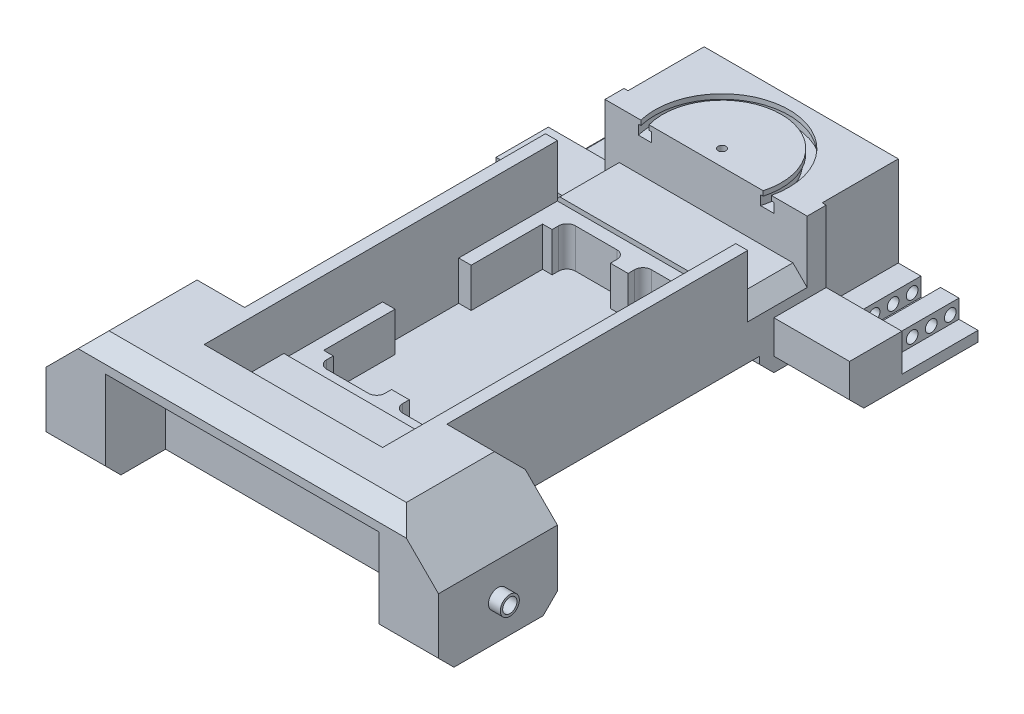
from build123d import *

# Parameters (mm, degrees)
SKETCH1_W           = 40
SKETCH1_H           = 60
SKETCH1_W_2         = 85
SKETCH1_H_2         = 125
SKETCH1_W_3         = 75
SKETCH1_H_3         = 115
SKETCH1_H_4         = 25
BOSS_EXTRUDE1_DEPTH = 22
SKETCH2_W           = 85
SKETCH2_H           = 125
BOSS_EXTRUDE2_DEPTH = 16.5
SKETCH4_W           = 85
SKETCH4_H           = 125
BOSS_EXTRUDE3_DEPTH = 2.5
BOSS_EXTRUDE4_DEPTH = 50
SKETCH9_W           = 40
SKETCH9_H           = 6
CUT_EXTRUDE2_DEPTH  = 50
SKETCH8_W           = 8.185
SKETCH8_H           = 4.325
SKETCH8_W_2         = 9.5
SKETCH8_H_2         = 37.925
CUT_EXTRUDE1_DEPTH  = 32
SKETCH10_W          = 40
SKETCH10_H          = 22
CUT_EXTRUDE3_DEPTH  = 30
SKETCH11_W          = 22
SKETCH11_H          = 20
CUT_EXTRUDE4_DEPTH  = 8.185
SKETCH12_W          = 75
SKETCH12_H          = 25
SKETCH12_W_2        = 5
CUT_EXTRUDE5_DEPTH  = 20
CHAMFER1_SIZE       = 6
CHAMFER2_SIZE       = 6
SKETCH14_W          = 75
SKETCH14_H          = 17.5
CUT_EXTRUDE6_DEPTH  = 20
SKETCH18_W          = 25
SKETCH18_H          = 50
BOSS_EXTRUDE5_DEPTH = 165
CHAMFER3_SIZE       = 16
SKETCH19_R          = 3
CUT_EXTRUDE7_DEPTH  = 20
CHAMFER4_SIZE       = 6.5
CHAMFER5_SIZE       = 6.5
SKETCH20_W          = 115
SKETCH20_H          = 18.75
SKETCH20_H_2        = 6.5
CUT_EXTRUDE8_DEPTH  = 20
CHAMFER6_SIZE       = 6.5
CHAMFER8_SIZE       = 20
CHAMFER9_SIZE       = 20
SKETCH21_R          = 2.45
CUT_EXTRUDE9_DEPTH  = 30
SKETCH22_R          = 4
SKETCH22_R_2        = 3
BOSS_EXTRUDE6_DEPTH = 5
SKETCH23_R          = 2.7
SKETCH23_R_2        = 1.65
CUT_EXTRUDE10_DEPTH = 6
BOSS_EXTRUDE7_START = -2
BOSS_EXTRUDE7_DEPTH = 2


# Read off the part's stored shape, not the designer's step: Boss-Extrude7
# Some blends are built 0.0001 mm under size
with BuildPart() as part:
    # Sketch1 → Boss-Extrude1 (new body)
    # profile 1 of 7: a face of its own
    with BuildSketch(Plane(origin=(0, 0, 0), x_dir=(1, 0, 0), z_dir=(0, 1, 0))):
        with Locations((-25, 150)):
            Rectangle(SKETCH1_W, SKETCH1_H)
    # profile 2 of 7: a face of its own
    with BuildSketch(Plane(origin=(0, 0, 0), x_dir=(1, 0, 0), z_dir=(0, 1, 0))):
        with Locations((37.5, 150)):
            Rectangle(SKETCH1_W_2, SKETCH1_H)
    # profile 3 of 7: a face of its own
    with BuildSketch(Plane(origin=(0, 0, 0), x_dir=(1, 0, 0), z_dir=(0, 1, 0))):
        with Locations((100, 150)):
            Rectangle(SKETCH1_W, SKETCH1_H)
    # profile 4 of 7: a face of its own
    with BuildSketch(Plane(origin=(0, 0, 0), x_dir=(1, 0, 0), z_dir=(0, 1, 0))):
        with Locations((37.5, 57.5)):
            Rectangle(SKETCH1_W_2, SKETCH1_H_2)
        with Locations((37.5, 57.5)):
            Rectangle(SKETCH1_W_3, SKETCH1_H_3, mode=Mode.SUBTRACT)
    # profile 5 of 7: a face of its own
    with BuildSketch(Plane(origin=(0, 0, 0), x_dir=(1, 0, 0), z_dir=(0, 1, 0))):
        with Locations((-25, -17.5)):
            Rectangle(SKETCH1_W, SKETCH1_H_4)
    # profile 6 of 7: a face of its own
    with BuildSketch(Plane(origin=(0, 0, 0), x_dir=(1, 0, 0), z_dir=(0, 1, 0))):
        with Locations((37.5, -17.5)):
            Rectangle(SKETCH1_W_2, SKETCH1_H_4)
    # profile 7 of 7: a face of its own
    with BuildSketch(Plane(origin=(0, 0, 0), x_dir=(1, 0, 0), z_dir=(0, 1, 0))):
        with Locations((100, -17.5)):
            Rectangle(SKETCH1_W, SKETCH1_H_4)
    extrude(amount=-BOSS_EXTRUDE1_DEPTH)

    # Sketch2 → Boss-Extrude2 (add)
    with BuildSketch(Plane.XZ.offset(22)):
        with Locations((37.5, -57.5)):
            Rectangle(SKETCH2_W, SKETCH2_H)
        with BuildLine():
            Line((5.25, -11.5), (9.275, -11.5))
            Line((9.275, -11.5), (9.275, -8.75))
            ThreePointArc((9.275, -8.75), (10.300126266, -6.275126266), (12.775, -5.25))
            Line((12.775, -5.25), (30.275, -5.25))
            ThreePointArc((30.275, -5.25), (32.749873734, -6.275126266), (33.775, -8.75))
            Line((33.775, -8.75), (33.775, -11.5))
            Line((33.775, -11.5), (41.223, -11.5))
            Line((41.223, -11.5), (41.223, -8.75))
            ThreePointArc((41.223, -8.75), (42.248126266, -6.275126266), (44.723, -5.25))
            Line((44.723, -5.25), (62.223, -5.25))
            ThreePointArc((62.223, -5.25), (64.697873734, -6.275126266), (65.723, -8.75))
            Line((65.723, -8.75), (65.723, -11.5))
            Line((65.723, -11.5), (69.75, -11.5))
            Line((69.75, -11.5), (69.75, -41.5))
            Line((69.75, -41.5), (75, -41.5))
            Line((75, -41.5), (75, -73.5))
            Line((75, -73.5), (69.75, -73.5))
            Line((69.75, -73.5), (69.75, -103.5))
            Line((69.75, -103.5), (65.723, -103.5))
            Line((65.723, -103.5), (65.723, -106.25))
            ThreePointArc((65.723, -106.25), (64.697873734, -108.724873734), (62.223, -109.75))
            Line((62.223, -109.75), (44.723, -109.75))
            ThreePointArc((44.723, -109.75), (42.248126266, -108.724873734), (41.223, -106.25))
            Line((41.223, -106.25), (41.223, -103.5))
            Line((41.223, -103.5), (33.775, -103.5))
            Line((33.775, -103.5), (33.775, -106.25))
            ThreePointArc((33.775, -106.25), (32.749873734, -108.724873734), (30.275, -109.75))
            Line((30.275, -109.75), (12.775, -109.75))
            ThreePointArc((12.775, -109.75), (10.300126266, -108.724873734), (9.275, -106.25))
            Line((9.275, -106.25), (9.275, -103.5))
            Line((9.275, -103.5), (5.25, -103.5))
            Line((5.25, -103.5), (5.25, -73.5))
            Line((5.25, -73.5), (0, -73.5))
            Line((0, -73.5), (0, -41.5))
            Line((0, -41.5), (5.25, -41.5))
            Line((5.25, -41.5), (5.25, -11.5))
        make_face(mode=Mode.SUBTRACT)
    extrude(amount=BOSS_EXTRUDE2_DEPTH)

    # Sketch4 → Boss-Extrude3 (add)
    with BuildSketch(Plane.XZ.offset(38.5)):
        with Locations((37.5, -57.5)):
            Rectangle(SKETCH4_W, SKETCH4_H)
    extrude(amount=BOSS_EXTRUDE3_DEPTH)

    # Sketch5 → Boss-Extrude4 (add)
    with BuildSketch(Plane(origin=(0, 0, 0), x_dir=(1, 0, 0), z_dir=(0, 1, 0))):
        Polygon((120, 180), (-45, 180), (-45, 120), (-5, 120), (80, 120), (120, 120), align=None)
        Polygon((-5, -5), (-45, -5), (-45, -30), (120, -30), (120, -5), (80, -5), align=None)
    extrude(amount=-BOSS_EXTRUDE4_DEPTH)

    # Sketch9 → Cut-Extrude2 (cut)
    with BuildSketch(Plane(origin=(0, 0, 0), x_dir=(1, 0, 0), z_dir=(0, 1, 0))):
        with Locations((-25, 123)):
            Rectangle(SKETCH9_W, SKETCH9_H)
        with Locations((100, 123)):
            Rectangle(SKETCH9_W, SKETCH9_H)
    extrude(amount=-CUT_EXTRUDE2_DEPTH, mode=Mode.SUBTRACT)

    # Sketch8 → Cut-Extrude1 (cut)
    with BuildSketch(Plane(origin=(0, 0, -180), x_dir=(-1, 0, 0), z_dir=(0, 0, -1))):
        Polygon((-87.815, 0), (-120, 0), (-120, -45.675), (-111.815, -45.675), (-103.815, -45.675), (-103.815, -37.925), (-96.065, -37.925), (-96.065, -45.675), (-87.815, -45.675), (-87.815, -37.925), align=None)
        with Locations((-115.9075, -47.8375)):
            Rectangle(SKETCH8_W, SKETCH8_H)
        with Locations((-83.065, -18.9625)):
            Rectangle(SKETCH8_W_2, SKETCH8_H_2)
    cut_extrude1 = extrude(amount=-CUT_EXTRUDE1_DEPTH, mode=Mode.SUBTRACT)

    # Sketch10 → Cut-Extrude3 (cut)
    with BuildSketch(Plane(origin=(0, 0, 0), x_dir=(1, 0, 0), z_dir=(0, 1, 0))):
        with Locations((100, 137)):
            Rectangle(SKETCH10_W, SKETCH10_H)
    cut_extrude3 = extrude(amount=-CUT_EXTRUDE3_DEPTH, mode=Mode.SUBTRACT)

    # Sketch11 → Cut-Extrude4 (cut)
    with BuildSketch(Plane(origin=(120, 0, 0), x_dir=(0, 0, -1), z_dir=(1, 0, 0))):
        with Locations((137, -40)):
            Rectangle(SKETCH11_W, SKETCH11_H)
    cut_extrude4 = extrude(amount=-CUT_EXTRUDE4_DEPTH, mode=Mode.SUBTRACT)

    # Sketch12 → Cut-Extrude5 (cut)
    with BuildSketch(Plane(origin=(0, 0, 0), x_dir=(1, 0, 0), z_dir=(0, 1, 0))):
        with Locations((37.5, 127.5)):
            Rectangle(SKETCH12_W, SKETCH12_H)
        with Locations((77.5, 127.5)):
            Rectangle(SKETCH12_W_2, SKETCH12_H)
    cut_extrude5 = extrude(amount=-CUT_EXTRUDE5_DEPTH, mode=Mode.SUBTRACT)

    # Mirror4: Cut-Extrude1, Cut-Extrude3, Cut-Extrude4, Cut-Extrude5 across plane
    add(cut_extrude1.mirror(Plane.ZY.offset(-37.5)), mode=Mode.SUBTRACT)
    add(cut_extrude3.mirror(Plane.ZY.offset(-37.5)), mode=Mode.SUBTRACT)
    add(cut_extrude4.mirror(Plane.ZY.offset(-37.5)), mode=Mode.SUBTRACT)
    add(cut_extrude5.mirror(Plane.ZY.offset(-37.5)), mode=Mode.SUBTRACT)

    # Chamfer1
    # the kernel refuses this chamfer: 6 mm, written as the material it takes off along each edge
    with BuildSketch(Plane(origin=(80, -20, -115), x_dir=(0.02749587661058678, -0.9996219169112968, 0), z_dir=(0, 0, -1))) as chamfer1_piece_1:
        Polygon((CHAMFER1_SIZE * 0.999621916911, CHAMFER1_SIZE * 0.0274958766106), (-CHAMFER1_SIZE * 0.0274958766106, CHAMFER1_SIZE * 0.999621916911), (0, 0), align=None)
    extrude(amount=25, mode=Mode.SUBTRACT)
    with BuildSketch(Plane(origin=(-5, -20, -115), x_dir=(-0.027495876610588648, -0.9996219169112965, 0), z_dir=(0, 0, -1))) as chamfer1_piece_2:
        Polygon((CHAMFER1_SIZE * 0.999621916911, -CHAMFER1_SIZE * 0.0274958766106), (-CHAMFER1_SIZE * 0.0274958766106, -CHAMFER1_SIZE * 0.999621916911), (0, 0), align=None)
    extrude(amount=25, mode=Mode.SUBTRACT)

    # Chamfer2
    chamfer2_edges = [part.edges().sort_by_distance(p)[0] for p in [
        (95.9075, -50, -126),
        (-20.9075, -50, -126),
        (37.5, -50, 5),
        (37.5, -50, -120),
    ]]
    chamfer(chamfer2_edges, length=CHAMFER2_SIZE - 0.0001)  # a hair under: the kernel refuses the full size

    # Sketch14 → Cut-Extrude6 (cut)
    with BuildSketch(Plane(origin=(0, 0, 0), x_dir=(1, 0, 0), z_dir=(0, 1, 0))):
        with Locations((37.5, -8.75)):
            Rectangle(SKETCH14_W, SKETCH14_H)
    extrude(amount=-CUT_EXTRUDE6_DEPTH, mode=Mode.SUBTRACT)

    # Sketch18 → Boss-Extrude5 (add)
    with BuildSketch(Plane.ZY.offset(45)):
        with Locations((42.5, -25)):
            Rectangle(SKETCH18_W, SKETCH18_H)
    extrude(amount=-BOSS_EXTRUDE5_DEPTH)

    # Chamfer3
    chamfer3_edges = [part.edges().sort_by_distance(p)[0] for p in [
        (37.5, 0, 17.5),
    ]]
    chamfer(chamfer3_edges, length=CHAMFER3_SIZE)

    # Sketch19 → Cut-Extrude7 (cut)
    with BuildSketch(Plane.ZY.offset(45)):
        with Locations((30, -34.24)):
            Circle(SKETCH19_R)
    cut_extrude7 = extrude(amount=-CUT_EXTRUDE7_DEPTH, mode=Mode.SUBTRACT)

    # Chamfer4
    chamfer4_edges = [part.edges().sort_by_distance(p)[0] for p in [
        (37.5, -50, 55),
    ]]
    chamfer(chamfer4_edges, length=CHAMFER4_SIZE)

    # Chamfer5
    chamfer5_edges = [part.edges().sort_by_distance(p)[0] for p in [
        (100, 0, 5),
        (-25, 0, 5),
    ]]
    chamfer(chamfer5_edges, length=CHAMFER5_SIZE)

    # Sketch20 → Cut-Extrude8 (cut)
    with BuildSketch(Plane.XZ.offset(50)):
        with Locations((37.5, 39.125)):
            Rectangle(SKETCH20_W, SKETCH20_H)
        with Locations((37.5, 51.75)):
            Rectangle(SKETCH20_W, SKETCH20_H_2)
    extrude(amount=-CUT_EXTRUDE8_DEPTH, mode=Mode.SUBTRACT)

    # Mirror5: Cut-Extrude7 across plane
    add(cut_extrude7.mirror(Plane.ZY.offset(-37.5)), mode=Mode.SUBTRACT)

    # Chamfer6
    chamfer6_edges = [part.edges().sort_by_distance(p)[0] for p in [
        (37.5, 0, 55),
    ]]
    chamfer(chamfer6_edges, length=CHAMFER6_SIZE)

    # Chamfer8
    chamfer8_edges = [part.edges().sort_by_distance(p)[0] for p in [
        (37.5, -30, 55),
    ]]
    chamfer(chamfer8_edges, length=CHAMFER8_SIZE)

    # Chamfer9
    chamfer9_edges = [part.edges().sort_by_distance(p)[0] for p in [
        (-45, 0, 30),
        (120, 0, 30),
    ]]
    chamfer(chamfer9_edges, length=CHAMFER9_SIZE)

    # Sketch21 → Cut-Extrude9 (cut)
    with BuildSketch(Plane.ZY.offset(36.815)):
        with Locations((-176.325, -42.24)):
            Circle(SKETCH21_R)
        with Locations((-168.325, -42.24)):
            Circle(SKETCH21_R)
        with Locations((-160.325, -42.24)):
            Circle(SKETCH21_R)
    cut_extrude9 = extrude(amount=-CUT_EXTRUDE9_DEPTH, mode=Mode.SUBTRACT)

    # Mirror6: Cut-Extrude9 across plane
    add(cut_extrude9.mirror(Plane.ZY.offset(-37.5)), mode=Mode.SUBTRACT)

    # Sketch22 → Boss-Extrude6 (add)
    with BuildSketch(Plane.ZY.offset(45)):
        with Locations(Location((30, -34.24, 0), (0, 0, 180))):
            Circle(SKETCH22_R)
        with Locations((30, -34.24)):
            Circle(SKETCH22_R_2, mode=Mode.SUBTRACT)
    boss_extrude6 = extrude(amount=BOSS_EXTRUDE6_DEPTH)

    # Mirror7: Boss-Extrude6 across plane
    add(boss_extrude6.mirror(Plane.ZY.offset(-37.5)))

    # Sketch23 → Cut-Extrude10 (cut)
    with BuildSketch(Plane(origin=(0, 0, 0), x_dir=(1, 0, 0), z_dir=(0, 1, 0))):
        with BuildLine():
            ThreePointArc((37.5, 175.966221554), (39.409188309, 175.175409863), (40.2, 173.266221554))
            ThreePointArc((40.2, 173.266221554), (39.409188309, 171.357033245), (37.5, 170.566221554))
            ThreePointArc((37.5, 170.566221554), (54.371054268, 163.578002065), (61.359273757, 146.706947797))
            ThreePointArc((61.359273757, 146.706947797), (61.117530795, 143.319148603), (60.397200604, 140))
            Line((60.397200604, 140), (65.980202809, 140))
            ThreePointArc((65.980202809, 140), (66.563853422, 143.330925719), (66.759273757, 146.706947797))
            ThreePointArc((66.759273757, 146.706947797), (58.189430886, 167.396378683), (37.5, 175.966221554))
        make_face()
        with BuildLine():
            ThreePointArc((37.5, 170.566221554), (34.8, 173.266221554), (37.5, 175.966221554))
            ThreePointArc((37.5, 175.966221554), (14.561544053, 164.870987534), (9.019797191, 140))
            Line((9.019797191, 140), (14.602799396, 140))
            ThreePointArc((14.602799396, 140), (18.404348037, 161.011528194), (37.5, 170.566221554))
        make_face()
        with Locations((37.5, 173.266221554)):
            Circle(SKETCH23_R)
        with Locations(Location((37.5, 146.706947797, 0), (0, 0, 270))):
            Circle(SKETCH23_R_2)
    extrude(amount=-CUT_EXTRUDE10_DEPTH, mode=Mode.SUBTRACT)

    # Boss-Extrude7 outline → Boss-Extrude7 (add)
    with BuildSketch(Plane(origin=(0, 0, 0), x_dir=(1, 0, 0), z_dir=(0, 1, 0)).offset(BOSS_EXTRUDE7_START)):
        with BuildLine():
            ThreePointArc((10.099635455, 140), (37.5, 174.916221554), (64.900364545, 140))
            Line((64.900364545, 140), (65.980202809, 140))
            ThreePointArc((65.980202809, 140), (37.5, 175.966221554), (9.019797191, 140))
            Line((9.019797191, 140), (10.099635455, 140))
        make_face()
        with BuildLine():
            Line((60.397200604, 140), (61.489347018, 140))
            ThreePointArc((61.489347018, 140), (37.5, 171.616221554), (13.510652982, 140))
            Line((13.510652982, 140), (14.602799396, 140))
            ThreePointArc((14.602799396, 140), (37.5, 170.566221554), (60.397200604, 140))
        make_face()
    extrude(amount=BOSS_EXTRUDE7_DEPTH)


solid = part.part
